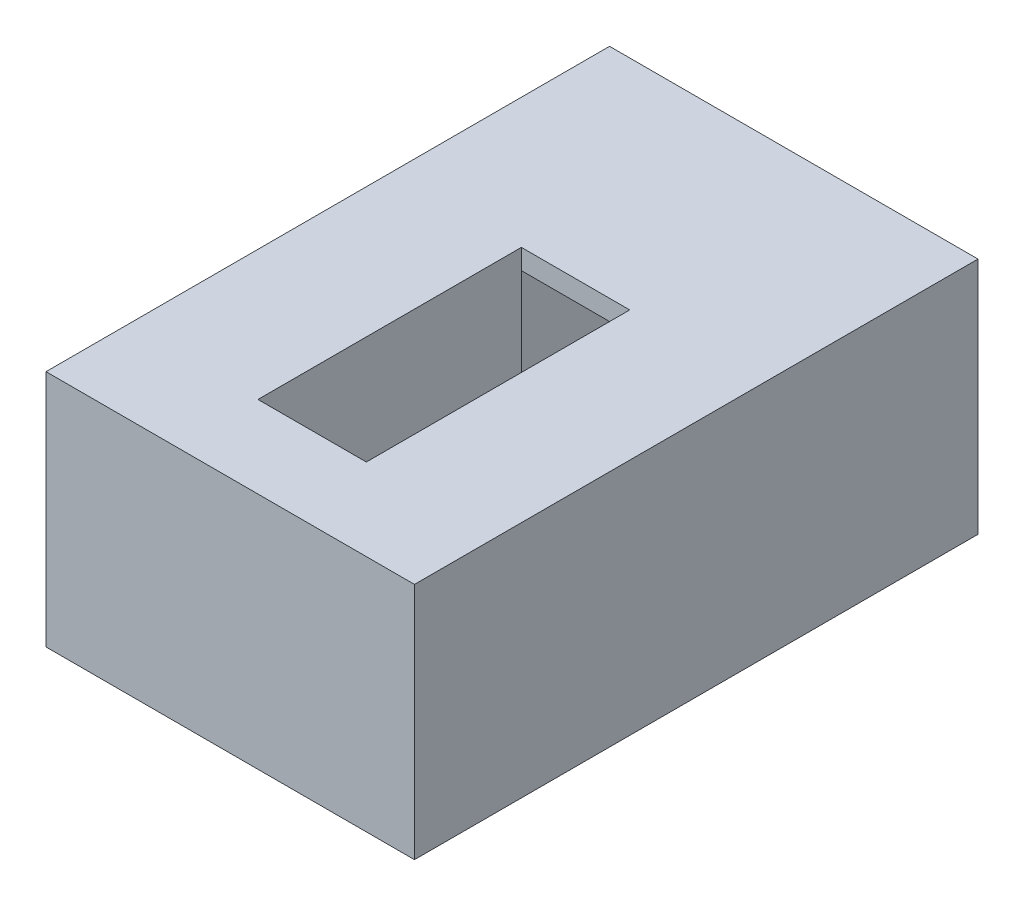
from build123d import *

# Parameters (mm, degrees)
SKETCH_1_W          = 5200
SKETCH_1_H          = 2200
EXTRUDE_1_DEPTH     = 1700
CUT_EXTRUDE_1_DEPTH = 500
SKETCH_4_W          = 1800
SKETCH_4_H          = 1694.637135117
CUT_EXTRUDE_2_DEPTH = 1000


with BuildPart() as part:
    # Эскиз1 → Бобышка-Вытянуть1 (new, symmetric)
    with BuildSketch(Plane(origin=(0, 0, 0), x_dir=(0, 0, -1), z_dir=(1, 0, 0))):
        Rectangle(SKETCH_1_W, SKETCH_1_H)
    extrude(amount=EXTRUDE_1_DEPTH, both=True)

    # Эскиз3 → Вырез-Вытянуть1 (cut, symmetric)
    with BuildSketch(Plane(origin=(0, 0, 0), x_dir=(0, 0, -1), z_dir=(1, 0, 0))):
        Polygon((-1844.132537204, 930.267244324), (-2363.513442227, 930.267244324), (-2363.513442227, -219.732755676), (586.486557773, -219.732755676), (586.486557773, -780.268672554), (2386.486557773, -780.268672554), (2386.486557773, 914.368462563), (586.486557773, 914.368462563), (586.486557773, 1100), (-1844.132537204, 1100), align=None)
    extrude(amount=CUT_EXTRUDE_1_DEPTH, both=True, mode=Mode.SUBTRACT)

    # Эскиз4 → Вырез-Вытянуть2 (cut, symmetric)
    with BuildSketch(Plane(origin=(0, 0, 0), x_dir=(0, 0, -1), z_dir=(1, 0, 0))):
        with Locations((1486.486557773, 67.049895005)):
            Rectangle(SKETCH_4_W, SKETCH_4_H)
    extrude(amount=CUT_EXTRUDE_2_DEPTH, both=True, mode=Mode.SUBTRACT)


solid = part.part
